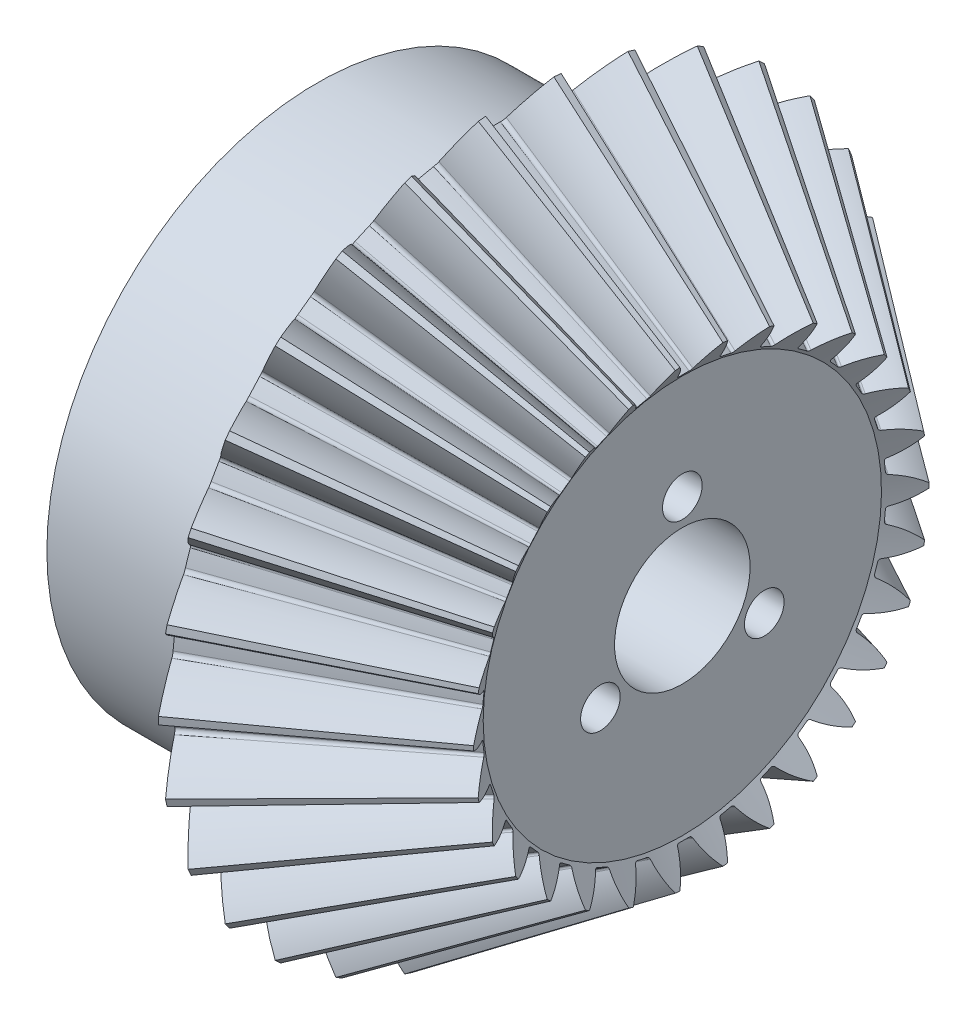
from build123d import *

# Parameters (mm, degrees)
TEETHCUTS_COUNT    = 30
TEETHCUTS_ANGLE    = 348
HUBSKE_R           = 30
HUB_DEPTH          = 19.133073486
BORSKE_R           = 3
BORE_DEPTH         = 77.0000508
SKETCH1_R          = 2.2
CUT_EXTRUDE1_DEPTH = 70.616342235
SKETCH2_R          = 7.525
CUT_EXTRUDE2_DEPTH = 70.616342235


with BuildPart() as part:
    # BasProSke → Base-Revolve (revolve)
    with BuildSketch(Plane(origin=(0, 0, 0), x_dir=(1, 0, 0), z_dir=(0, 1, 0)), mode=Mode.PRIVATE) as base_revolve_sk:
        Polygon((0, 0), (0, 35.074457831), (3.3581704, 40.111713423), (23.515553104, 25.278396537), (21.399234558, 22.103918723), (21.399234558, 0), align=None)
    revolve(base_revolve_sk.sketch.rotate(Axis((-10, 0, 0), (1, 0, 0)), 180), axis=Axis((-10, 0, 0), (1, 0, 0)))

    # ToothCut: read off the stored shape, not the designer's step
    # ToothCut: loft between two sections, ruled curve by curve
    toothcut_from = [
        Edge.make_bspline([(57.871713134, 0.007027529, -0.009484391), (57.868395092, 0.002050465, -0.014811229), (57.863976618, -0.004577246, -0.013970807), (57.861348277, -0.008519758, -0.007512929)], [0, 0, 0, 0, 1, 1, 1, 1], 3, [1, 0.781933424, 0.781933424, 1]),
        Edge.make_bspline([(57.861348277, -0.008519758, 0.007512929), (57.863976618, -0.004577246, 0.013970807), (57.868395092, 0.002050465, 0.014811229), (57.871713134, 0.007027529, 0.009484391)], [0, 0, 0, 0, 1, 1, 1, 1], 3, [1, 0.781933424, 0.781933424, 1]),
        Edge.make_bspline([(57.861348277, -0.008519758, -0.007512929), (57.86099964, -0.009042713, -0.006656321), (57.860713045, -0.009472606, -0.005727955), (57.860492976, -0.009802709, -0.004742354)], [0, 0, 0, 0, 1, 1, 1, 1], 3, [1, 0.994785241, 0.994785241, 1]),
        Edge.make_bspline([(57.860492976, -0.009802709, 0.004742354), (57.860713045, -0.009472606, 0.005727955), (57.86099964, -0.009042713, 0.006656321), (57.861348277, -0.008519758, 0.007512929)], [0, 0, 0, 0, 1, 1, 1, 1], 3, [1, 0.994785241, 0.994785241, 1]),
        Edge.make_bspline([(57.860492976, -0.009802709, -0.004742354), (57.859804932, -0.010834775, -0.001660878), (57.859804932, -0.010834775, 0.001660878), (57.860492976, -0.009802709, 0.004742354)], [0, 0, 0, 0, 1, 1, 1, 1], 3, [1, 0.951776612, 0.951776612, 1]),
        Edge.make_line((57.871713134, 0.007027529, 0.009484391), (57.871713134, 0.007027529, -0.009484391)),
    ]
    toothcut_to = [
        Edge.make_bspline([(3.680801317, 40.595659797, -4.371429588), (2.754803095, 39.206662467, -2.951006948), (1.68062342, 37.595392957, -1.924198614), (0.508858003, 35.837744834, -1.339369024)], [0, 0, 0, 0, 1, 1, 1, 1], 3, [1, 0.984299426, 0.984299426, 1]),
        Edge.make_bspline([(0.508858003, 35.837744834, 1.339369024), (1.68062342, 37.595392957, 1.924198614), (2.754803095, 39.206662467, 2.951006948), (3.680801317, 40.595659797, 4.371429588)], [0, 0, 0, 0, 1, 1, 1, 1], 3, [1, 0.984299426, 0.984299426, 1]),
        Edge.make_bspline([(0.508858003, 35.837744834, -1.339369024), (0.388597218, 35.657353657, -1.279346716), (0.314283719, 35.545883408, -1.098630922), (0.317383975, 35.550533792, -0.873741898)], [0, 0, 0, 0, 1, 1, 1, 1], 3, [1, 0.858857096, 0.858857096, 1]),
        Edge.make_bspline([(0.317383975, 35.550533792, 0.873741898), (0.314283719, 35.545883408, 1.098630922), (0.388597218, 35.657353657, 1.279346716), (0.508858003, 35.837744834, 1.339369024)], [0, 0, 0, 0, 1, 1, 1, 1], 3, [1, 0.858857096, 0.858857096, 1]),
        Edge.make_bspline([(0.317383975, 35.550533792, -0.873741898), (0.325413252, 35.562577708, -0.291307247), (0.325413252, 35.562577708, 0.291307247), (0.317383975, 35.550533792, 0.873741898)], [0, 0, 0, 0, 1, 1, 1, 1], 3, [1, 0.999794212, 0.999794212, 1]),
        Edge.make_line((3.680801317, 40.595659797, 4.371429588), (3.680801317, 40.595659797, -4.371429588)),
    ]
    toothcut = Solid(Shell([*[Face.make_surface_from_curves(toothcut_from[k], toothcut_to[k]) for k in range(6)], Face(Wire(toothcut_from)), Face(Wire(toothcut_to))]))
    add(toothcut, mode=Mode.SUBTRACT)

    # TeethCuts: ToothCut ×30 about axis
    teethcuts_axis = Axis((-10, 0, 0), (1, 0, 0))
    for i in range(1, TEETHCUTS_COUNT):
        add(toothcut.rotate(teethcuts_axis, i * TEETHCUTS_ANGLE / (TEETHCUTS_COUNT - 1)), mode=Mode.SUBTRACT)

    # HubSke → Hub (add)
    with BuildSketch(Plane.ZY):
        with Locations(Location((0, 0, 0), (0, 0, 180))):
            Circle(HUBSKE_R)
    extrude(amount=HUB_DEPTH)

    # BorSke → Bore (cut, symmetric)
    with BuildSketch(Plane(origin=(0, 0, 0), x_dir=(0, 0, -1), z_dir=(1, 0, 0))):
        with Locations(Location((0, 0, 0), (0, 0, 180))):
            Circle(BORSKE_R)
    extrude(amount=BORE_DEPTH, both=True, mode=Mode.SUBTRACT)

    # Sketch1 → Cut-Extrude1 (cut, through all)
    with BuildSketch(Plane(origin=(21.399234558, 0, 0), x_dir=(0, 0, -1), z_dir=(1, 0, 0))):
        with Locations((-9.09326674, -5.25)):
            Circle(SKETCH1_R)
        with Locations((0, 10.5)):
            Circle(SKETCH1_R)
        with Locations((9.09326674, -5.25)):
            Circle(SKETCH1_R)
    extrude(amount=-CUT_EXTRUDE1_DEPTH, mode=Mode.SUBTRACT)

    # Sketch2 → Cut-Extrude2 (cut, through all)
    with BuildSketch(Plane(origin=(21.399234558, 0, 0), x_dir=(0, 0, -1), z_dir=(1, 0, 0))):
        Circle(SKETCH2_R)
    extrude(amount=-CUT_EXTRUDE2_DEPTH, mode=Mode.SUBTRACT)


solid = part.part
